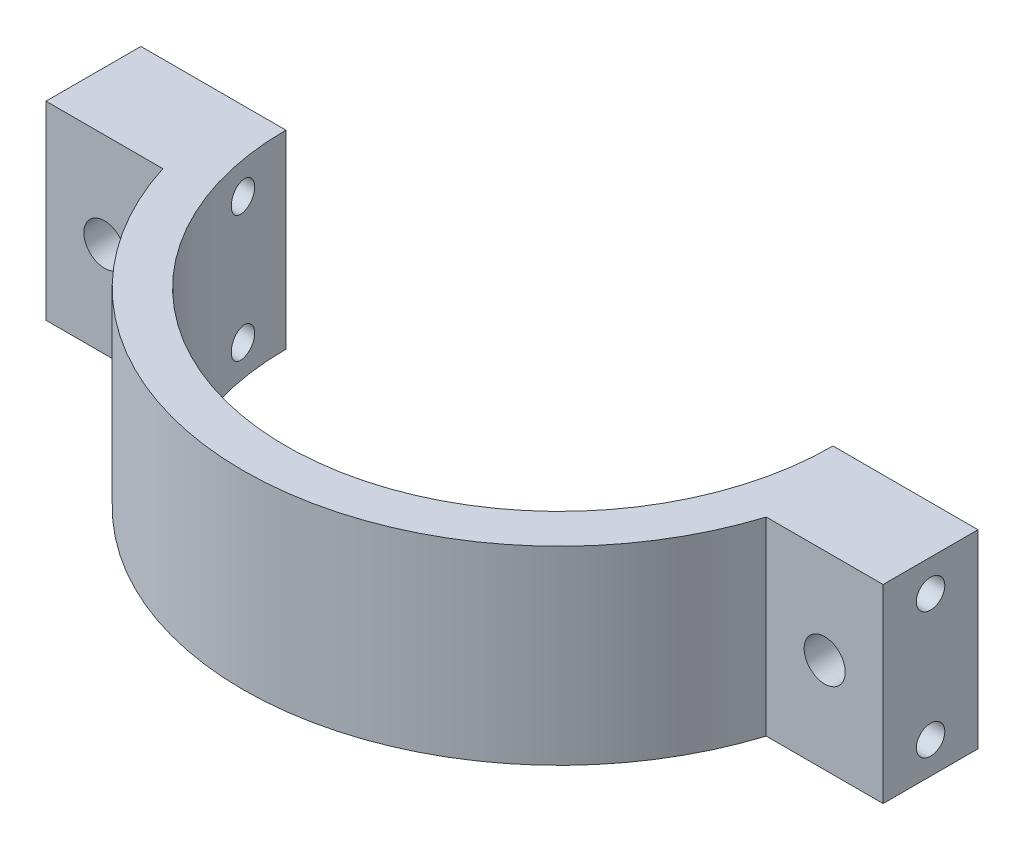
from build123d import *

# Parameters (mm, degrees)
BOSS_EXTRUDE1_DEPTH = 15
SKETCH2_R           = 3.25
CUT_EXTRUDE1_DEPTH  = 77.348743441
SKETCH3_R           = 2.25
CUT_EXTRUDE2_DEPTH  = 143.272704691


with BuildPart() as part:
    # Sketch1 → Boss-Extrude1 (new, symmetric)
    with BuildSketch(Plane(origin=(0, 0, 0), x_dir=(1, 0, 0), z_dir=(0, 1, 0))):
        with BuildLine():
            Line((-43.25, 0), (-66.175, 0))
            Line((-66.175, 0), (-66.175, -15))
            Line((-66.175, -15), (-47.696960071, -15))
            ThreePointArc((-47.696960071, -15), (0, -50), (47.696960071, -15))
            Line((47.696960071, -15), (66.175, -15))
            Line((66.175, -15), (66.175, 0))
            Line((66.175, 0), (43.25, 0))
            ThreePointArc((43.25, 0), (0, -43.25), (-43.25, 0))
        make_face()
    extrude(amount=BOSS_EXTRUDE1_DEPTH, both=True)

    # Sketch2 → Cut-Extrude1 (cut, through all)
    with BuildSketch(Plane.XY.offset(15)):
        with Locations((-56.935980035, 0)):
            Circle(SKETCH2_R)
        with Locations((56.935980035, 0)):
            Circle(SKETCH2_R)
    extrude(amount=-CUT_EXTRUDE1_DEPTH, mode=Mode.SUBTRACT)

    # Sketch3 → Cut-Extrude2 (cut, through all)
    with BuildSketch(Plane.ZY.offset(66.175)):
        with Locations((7.5, -10)):
            Circle(SKETCH3_R)
        with Locations((7.5, 10)):
            Circle(SKETCH3_R)
    extrude(amount=-CUT_EXTRUDE2_DEPTH, mode=Mode.SUBTRACT)


solid = part.part
